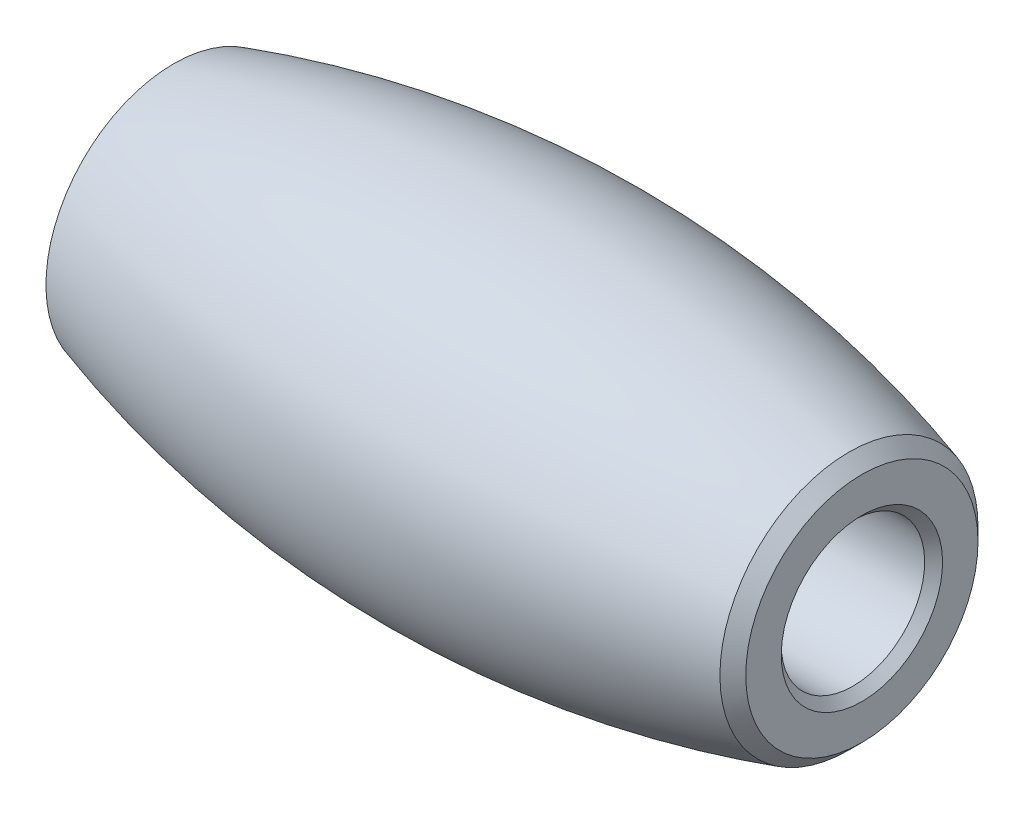
from build123d import *

# Parameters (mm, degrees)
CHAMFER1_SIZE   = 0.5
CHAMFER1_SIZE_2 = 0.765486726


with BuildPart() as part:
    # Sketch1 → Revolve1 (revolve)
    with BuildSketch(Plane.XY, mode=Mode.PRIVATE) as revolve1_sk:
        with BuildLine():
            Line((19.5, 7), (19.5, 4.015))
            Line((19.5, 4.015), (9.5, 4.015))
            Line((9.5, 4.015), (9.5, 3))
            Line((9.5, 3), (-9.5, 3))
            Line((-9.5, 3), (-9.5, 4.015))
            Line((-9.5, 4.015), (-19.5, 4.015))
            Line((-19.5, 4.015), (-19.5, 7))
            ThreePointArc((-19.5, 7), (0, 10), (19.5, 7))
        make_face()
    revolve(revolve1_sk.sketch.rotate(Axis((-19.5, 0, 0), (1, 0, 0)), 180), axis=Axis((-19.5, 0, 0), (1, 0, 0)))

    # Chamfer1
    # the kernel refuses this chamfer: 0.765486726, 0.5 mm, written as the material it takes off along each edge
    with BuildSketch(Plane(origin=(19.5, 0, 0), x_dir=(0, -1, 0), z_dir=(0, 0, 1))) as chamfer1_piece_1:
        with BuildLine():
            Line((7 - CHAMFER1_SIZE, 0), (7.223326537, -0.723326537))
            ThreePointArc((7.223326537, -0.723326537), (7.116710271, -0.374271708), (7, 0))
            Line((7, 0), (7 - CHAMFER1_SIZE, 0))
        make_face()
    revolve(axis=Axis((19.5, 0, 0), (1, 0, 0)), mode=Mode.SUBTRACT)
    with BuildSketch(Plane(origin=(-19.5, 0, 0), x_dir=(0, -1, 0), z_dir=(0, 0, 1))) as chamfer1_piece_2:
        with BuildLine():
            Line((7 - CHAMFER1_SIZE_2, 0), (7.147890601, 0.475629668))
            ThreePointArc((7.147890601, 0.475629668), (7.077602322, 0.247969183), (7, 0))
            Line((7, 0), (7 - CHAMFER1_SIZE_2, 0))
        make_face()
    revolve(axis=Axis((-19.5, 0, 0), (1, 0, 0)), mode=Mode.SUBTRACT)
    with BuildSketch(Plane(origin=(-19.5, 0, 0), x_dir=(0, -1, 0), z_dir=(0, 0, 1))) as chamfer1_piece_3:
        Polygon((4.015, CHAMFER1_SIZE), (4.015 + CHAMFER1_SIZE, 0), (4.015, 0), align=None)
    revolve(axis=Axis((-19.5, 0, 0), (1, 0, 0)), mode=Mode.SUBTRACT)
    with BuildSketch(Plane(origin=(19.5, 0, 0), x_dir=(0, -1, 0), z_dir=(0, 0, 1))) as chamfer1_piece_4:
        Polygon((4.015 + CHAMFER1_SIZE, 0), (4.015, -CHAMFER1_SIZE), (4.015, 0), align=None)
    revolve(axis=Axis((19.5, 0, 0), (1, 0, 0)), mode=Mode.SUBTRACT)


solid = part.part
